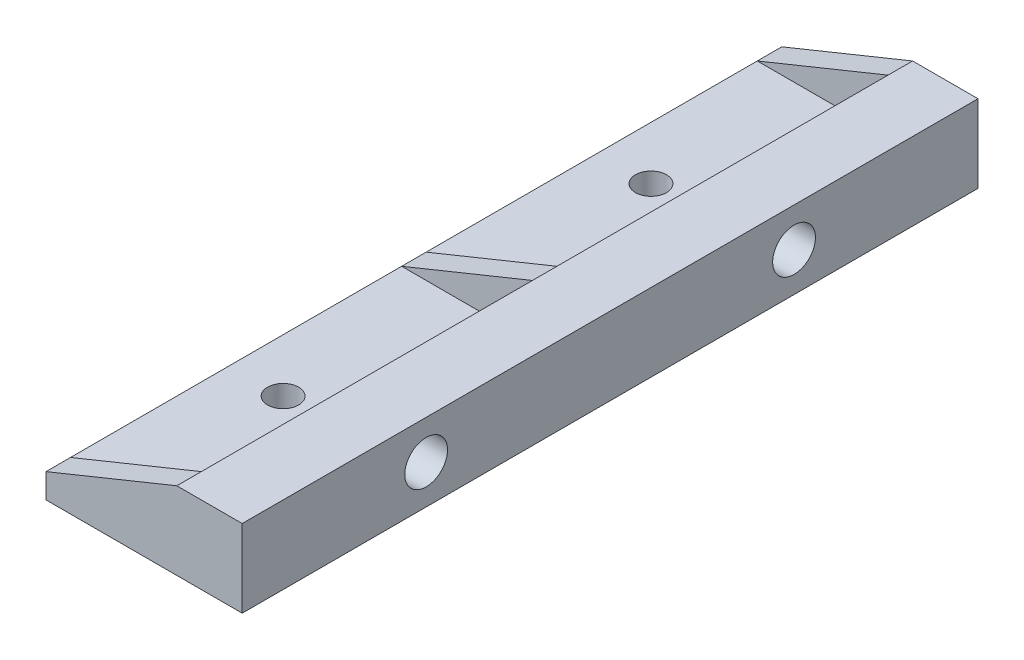
from build123d import *

# Parameters (mm, degrees)
BOSS_EXTRUDE1_DEPTH   = 90
RIB3_REACH            = 53.877
SKETCH4_WALL_W        = 123.024434014
SKETCH4_WALL_H        = 3
RIB4_START            = -3
RIB4_DEPTH            = 3
F_6_CLEARANCE_HOLE1_D = 3.7973
SKETCH6_R             = 2.3495
CUT_EXTRUDE1_DEPTH    = 7
SKETCH12_R            = 2.6162
CUT_EXTRUDE2_DEPTH    = 6.35


# Read off the part's stored shape, not the designer's step: Rib4
with BuildPart() as part:
    # Sketch1 → Boss-Extrude1 (new body)
    with BuildSketch(Plane.XY):
        with BuildLine():
            Line((0, 0), (0, 9.5))
            Line((0, 9.5), (-8, 9.5))
            Line((-8, 9.5), (-8, 6))
            ThreePointArc((-8, 6), (-8.878679656, 3.878679656), (-11, 3))
            Line((-11, 3), (-24, 3))
            Line((-24, 3), (-24, 0))
            Line((-24, 0), (0, 0))
        make_face()
    extrude(amount=BOSS_EXTRUDE1_DEPTH)

    # Sketch4 wall → Rib3 (add, up to next)
    with BuildSketch(Plane(origin=(-16, 6.25, 45), x_dir=(-0.926466577122, -0.376377046956, 0), z_dir=(-0.376377046956, 0.926466577122, 0)), mode=Mode.PRIVATE) as rib3_sk1:
        Rectangle(SKETCH4_WALL_W, SKETCH4_WALL_H)
    rib3_tool1 = extrude(rib3_sk1.sketch, amount=-RIB3_REACH, mode=Mode.PRIVATE) - part.part
    add(rib3_tool1.solids().sort_by_distance((-16, 6.25, 45))[0])

    # Rib4 outline → Rib4 (add)
    with BuildSketch(Plane(origin=(0, 0, 0), x_dir=(-1, 0, 0), z_dir=(0, 0, -1)).offset(RIB4_START)):
        with BuildLine():
            Line((24, 3), (8, 9.5))
            Line((8, 9.5), (8, 6))
            ThreePointArc((8, 6), (8.878679656, 3.878679656), (11, 3))
            Line((11, 3), (24, 3))
        make_face()
    rib4 = extrude(amount=RIB4_DEPTH)

    # Mirror1: Rib4 across plane
    add(rib4.mirror(Plane(origin=(0, 0, 45), x_dir=(1, 0, 0), z_dir=(0, 0, -1))))

    # #6 Clearance Hole1 (through all)
    with Locations(Plane(origin=(0, 0, 0), x_dir=(-1, 0, 0), z_dir=(0, -1, 0))):
        with Locations((17.5, -22.5), (17.5, -67.5)):
            Hole(F_6_CLEARANCE_HOLE1_D / 2)

    # Sketch6 → Cut-Extrude1 (cut)
    with BuildSketch(Plane(origin=(0, 0, 0), x_dir=(0, 0, -1), z_dir=(1, 0, 0))):
        with Locations((-67.5, 4.75)):
            Circle(SKETCH6_R)
        with Locations((-22.5, 4.75)):
            Circle(SKETCH6_R)
    extrude(amount=-CUT_EXTRUDE1_DEPTH, mode=Mode.SUBTRACT)

    # Sketch12 → Cut-Extrude2 (cut)
    with BuildSketch(Plane(origin=(0, 0, 0), x_dir=(0, 0, -1), z_dir=(1, 0, 0))):
        with Locations((-67.5, 4.75)):
            Circle(SKETCH12_R)
        with Locations((-22.5, 4.75)):
            Circle(SKETCH12_R)
    extrude(amount=-CUT_EXTRUDE2_DEPTH, mode=Mode.SUBTRACT)


solid = part.part
